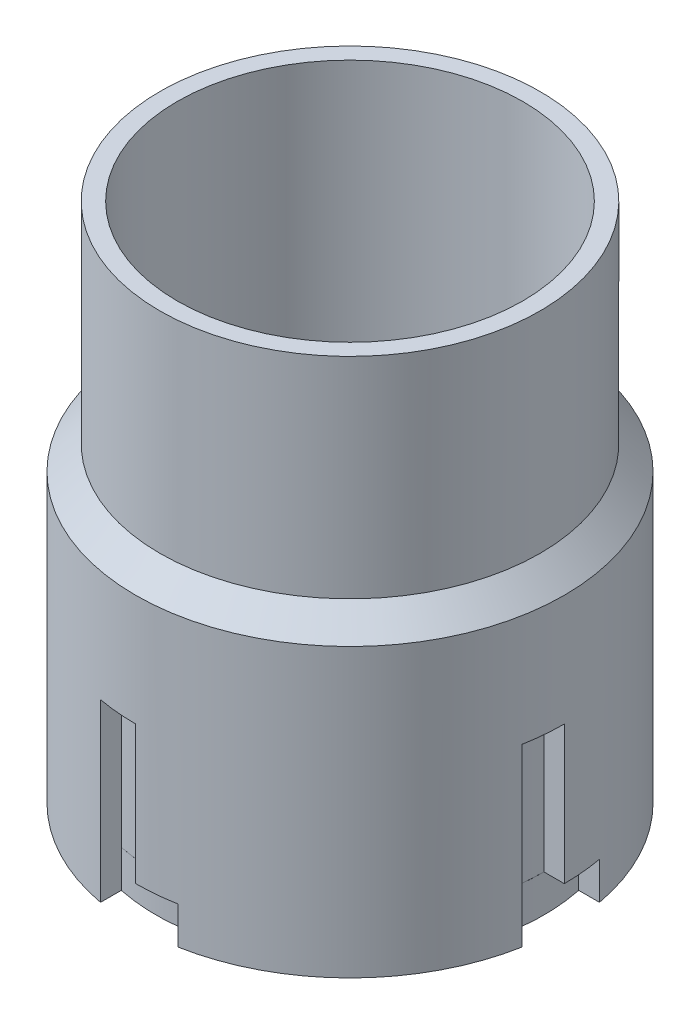
from build123d import *

# Parameters (mm, degrees)
SKETCH1_R           = 39.37
BOSS_EXTRUDE1_DEPTH = 101.6
SKETCH2_R           = 31.75
CUT_EXTRUDE1_DEPTH  = 116.855745649
CUT_EXTRUDE2_START  = -33.02
SKETCH3_R           = 39.37
SKETCH3_R_2         = 34.925
CUT_EXTRUDE2_DEPTH  = 33.02
CUT_EXTRUDE3_DEPTH  = 12.7
SKETCH9_R           = 39.558823483
CUT_EXTRUDE5_DEPTH  = 111.768173967
SKETCH10_R          = 3.268271246
BOSS_EXTRUDE2_DEPTH = 10.16
CUT_EXTRUDE6_DEPTH  = 25.4
CIRPATTERN1_COUNT   = 4
CHAMFER1_SIZE       = 10


with BuildPart() as part:
    # Sketch1 → Boss-Extrude1 (new body)
    with BuildSketch(Plane(origin=(0, 0, 0), x_dir=(1, 0, 0), z_dir=(0, 1, 0))):
        with Locations(Location((0, 0, 0), (0, 0, 270))):
            Circle(SKETCH1_R)
    extrude(amount=BOSS_EXTRUDE1_DEPTH)

    # Sketch2 → Cut-Extrude1 (cut, through all)
    with BuildSketch(Plane(origin=(0, 101.6, 0), x_dir=(1, 0, 0), z_dir=(0, 1, 0))):
        with Locations(Location((0, 0, 0), (0, 0, 270))):
            Circle(SKETCH2_R)
    extrude(amount=-CUT_EXTRUDE1_DEPTH, mode=Mode.SUBTRACT)

    # Sketch3 → Cut-Extrude2 (cut)
    with BuildSketch(Plane(origin=(0, 101.6, 0), x_dir=(1, 0, 0), z_dir=(0, 1, 0)).offset(CUT_EXTRUDE2_START)):
        with Locations(Location((0, 0, 0), (0, 0, 270))):
            Circle(SKETCH3_R)
        with Locations(Location((0, 0, 0), (0, 0, 270))):
            Circle(SKETCH3_R_2, mode=Mode.SUBTRACT)
    extrude(amount=CUT_EXTRUDE2_DEPTH, mode=Mode.SUBTRACT)

    # Sketch5 → Cut-Extrude3 (cut)
    with BuildSketch(Plane.XZ):
        with BuildLine():
            Line((-7.112, -34.912297917), (-7.112, -38.722297917))
            ThreePointArc((-7.112, -38.722297917), (0, -39.380800166), (7.112, -38.722297917))
            Line((7.112, -38.722297917), (7.112, -34.912297917))
            ThreePointArc((7.112, -34.912297917), (0, -35.642563047), (-7.112, -34.912297917))
        make_face()
    cut_extrude3 = extrude(amount=-CUT_EXTRUDE3_DEPTH, mode=Mode.SUBTRACT)

    # Sketch9 → Cut-Extrude5 (cut, through all)
    with BuildSketch(Plane(origin=(0, 5.842, 0), x_dir=(-1, 0, 0), z_dir=(0, -1, 0))):
        Circle(SKETCH9_R)
    extrude(amount=CUT_EXTRUDE5_DEPTH, mode=Mode.SUBTRACT)

    # Sketch10 → Boss-Extrude2 (add)
    with BuildSketch(Plane.XZ.offset(-5.842)):
        with Locations(Location((-22.318582537, -27.07979346, 0), (0, 0, 270))):
            Circle(SKETCH10_R)
    extrude(amount=BOSS_EXTRUDE2_DEPTH)

    # Sketch23 → Cut-Extrude6 (cut)
    with BuildSketch(Plane.XZ.offset(-12.7)):
        with BuildLine():
            Line((0, -39.37), (0, -35.629329068))
            ThreePointArc((0, -35.629329068), (3.574027059, -35.449618058), (7.112, -34.912297917))
            Line((7.112, -34.912297917), (7.112, -38.722297917))
            ThreePointArc((7.112, -38.722297917), (3.570716384, -39.20774011), (0, -39.37))
        make_face()
    cut_extrude6 = extrude(amount=-CUT_EXTRUDE6_DEPTH, mode=Mode.SUBTRACT)

    # CirPattern1: Cut-Extrude3, Cut-Extrude6 ×4 about axis
    cirpattern1_axis = Axis((0, 0, 0), (0, 1, 0))
    add([cut_extrude3.rotate(cirpattern1_axis, i * 360 / CIRPATTERN1_COUNT) for i in range(1, CIRPATTERN1_COUNT)], mode=Mode.SUBTRACT)
    add([cut_extrude6.rotate(cirpattern1_axis, i * 360 / CIRPATTERN1_COUNT) for i in range(1, CIRPATTERN1_COUNT)], mode=Mode.SUBTRACT)

    # Chamfer1
    # the kernel refuses this chamfer: 10 mm, written as the material it takes off along each edge
    with BuildSketch(Plane(origin=(0, 68.58, 0), x_dir=(0, 0, 1), z_dir=(-1, 0, 0))) as chamfer1_piece_1_section:
        Polygon((39.37, -CHAMFER1_SIZE), (39.37 - CHAMFER1_SIZE, 0), (39.37, 0), align=None)
    chamfer1_piece_1 = revolve(axis=Axis((0, 68.58, 0), (0, 1, 0)), mode=Mode.PRIVATE)
    chamfer1_piece_1 = chamfer1_piece_1 - Plane(origin=(0, 60.807735234, 0), x_dir=(0, 0, 1), z_dir=(0, -1, 0)) * Cylinder(34.925, 158, mode=Mode.PRIVATE)
    add(chamfer1_piece_1, mode=Mode.SUBTRACT)


solid = part.part
